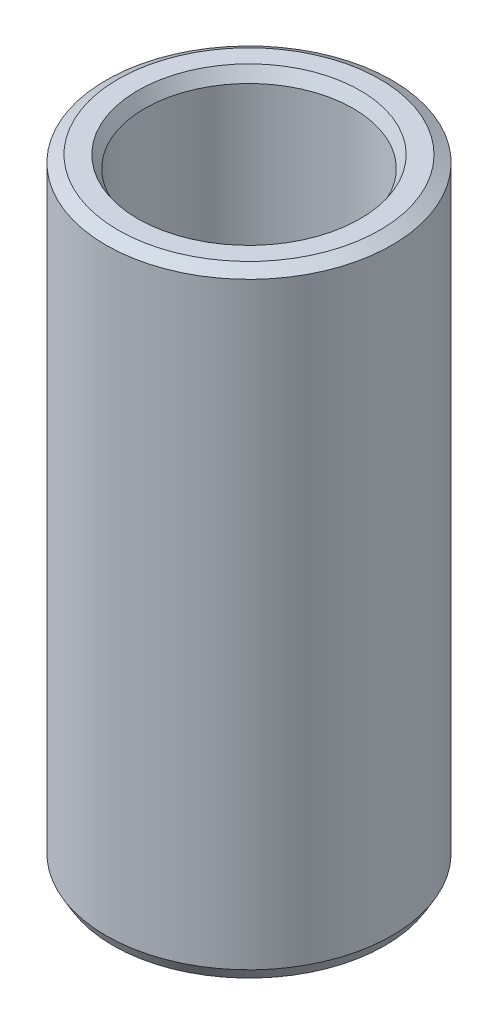
from build123d import *
from OCP.BRepFilletAPI import BRepFilletAPI_MakeChamfer

# Parameters (mm, degrees)
SKETCH1_R           = 15
BOSS_EXTRUDE1_DEPTH = 64.754906572
SKETCH2_R           = 10.936047625
CUT_EXTRUDE1_DEPTH  = 69.141014999
CHAMFER1_SIZE       = 0.731904941
CHAMFER1_SIZE2      = 1.267696545


with BuildPart() as part:
    # Sketch1 → Boss-Extrude1 (new body)
    with BuildSketch(Plane(origin=(0, 0, 0), x_dir=(1, 0, 0), z_dir=(0, 1, 0))):
        Circle(SKETCH1_R)
    extrude(amount=BOSS_EXTRUDE1_DEPTH)

    # Sketch2 → Cut-Extrude1 (cut, through all)
    with BuildSketch(Plane(origin=(0, 0, 0), x_dir=(1, 0, 0), z_dir=(0, 1, 0))):
        Circle(SKETCH2_R)
    extrude(amount=CUT_EXTRUDE1_DEPTH, mode=Mode.SUBTRACT)

    # Chamfer1: one chamfer whose edges measure the first distance from different faces: ONE call of the kernel's chamfer builder (chamfer() names one face for all edges)
    chamfer1_edges_1 = [part.edges().sort_by_distance(p)[0] for p in [
        (-10.936047625, 64.754906572, 0),
    ]]
    chamfer1_side_1 = [part.faces().sort_by_distance(p)[0] for p in [
        (-14.575735931, 64.754906572, 0),
    ]]
    chamfer1_edges_2 = [part.edges().sort_by_distance(p)[0] for p in [
        (-10.936047625, 0, 0),
    ]]
    chamfer1_side_2 = [part.faces().sort_by_distance(p)[0] for p in [
        (-10.936047625, 32.377453286, 0),
    ]]
    chamfer1_edges_3 = [part.edges().sort_by_distance(p)[0] for p in [
        (-15, 0, 0),
    ]]
    chamfer1_side_3 = [part.faces().sort_by_distance(p)[0] for p in [
        (-14.575735931, 0, 0),
    ]]
    chamfer1_edges_4 = [part.edges().sort_by_distance(p)[0] for p in [
        (-15, 64.754906572, 0),
    ]]
    chamfer1_side_4 = [part.faces().sort_by_distance(p)[0] for p in [
        (-15, 32.377453286, 0),
    ]]
    chamfer1 = BRepFilletAPI_MakeChamfer(part.part.solid().wrapped)
    for e in chamfer1_edges_1:
        chamfer1.Add(CHAMFER1_SIZE, CHAMFER1_SIZE2, e.wrapped, chamfer1_side_1[0].wrapped)  # the first distance lies on this face
    for e in chamfer1_edges_2:
        chamfer1.Add(CHAMFER1_SIZE, CHAMFER1_SIZE2, e.wrapped, chamfer1_side_2[0].wrapped)  # the first distance lies on this face
    for e in chamfer1_edges_3:
        chamfer1.Add(CHAMFER1_SIZE, CHAMFER1_SIZE2, e.wrapped, chamfer1_side_3[0].wrapped)  # the first distance lies on this face
    for e in chamfer1_edges_4:
        chamfer1.Add(CHAMFER1_SIZE, CHAMFER1_SIZE2, e.wrapped, chamfer1_side_4[0].wrapped)  # the first distance lies on this face
    add(Compound.cast(chamfer1.Shape()), mode=Mode.REPLACE)


solid = part.part
